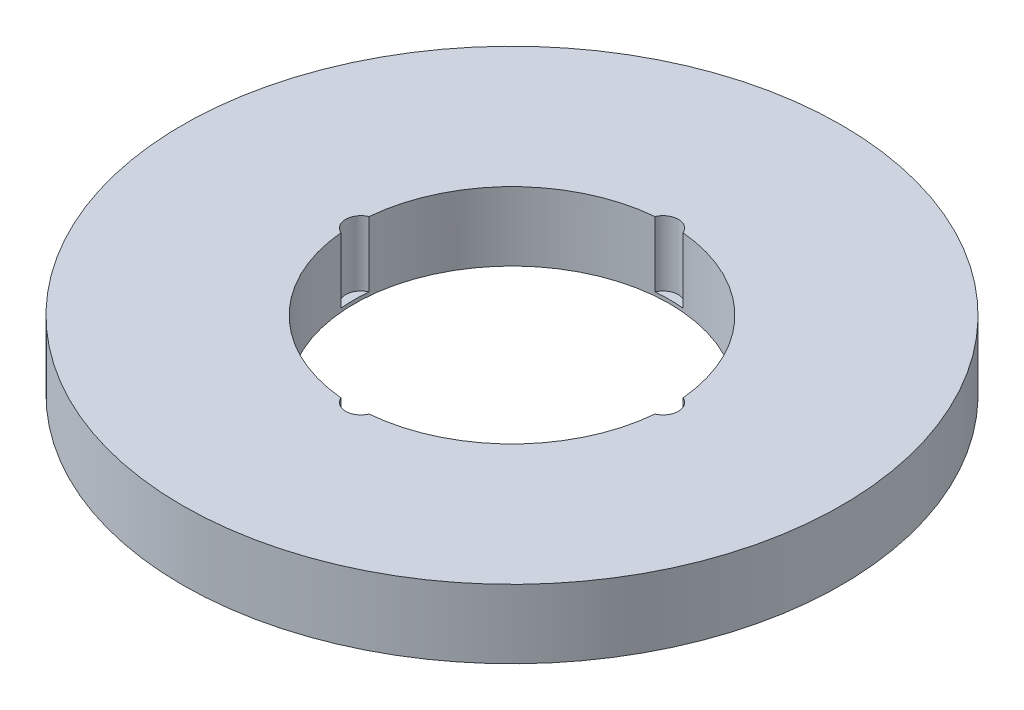
from build123d import *

# Parameters (mm, degrees)
SKETCH1_R           = 57.5
BOSS_EXTRUDE1_DEPTH = 12
SKETCH2_R           = 27.5
CUT_EXTRUDE1_DEPTH  = 83.197931847
SKETCH3_R           = 2.656470454
CUT_EXTRUDE2_DEPTH  = 11.388552756
CIRPATTERN1_COUNT   = 4


with BuildPart() as part:
    # Sketch1 → Boss-Extrude1 (new body)
    with BuildSketch(Plane(origin=(0, 0, 0), x_dir=(1, 0, 0), z_dir=(0, 1, 0))):
        Circle(SKETCH1_R)
    extrude(amount=BOSS_EXTRUDE1_DEPTH)

    # Sketch2 → Cut-Extrude1 (cut, through all)
    with BuildSketch(Plane(origin=(0, 0, 0), x_dir=(1, 0, 0), z_dir=(0, 1, 0))):
        Circle(SKETCH2_R)
    extrude(amount=CUT_EXTRUDE1_DEPTH, mode=Mode.SUBTRACT)

    # Sketch3 → Cut-Extrude2 (cut)
    with BuildSketch(Plane(origin=(0, 12, 0), x_dir=(1, 0, 0), z_dir=(0, 1, 0))):
        with Locations((-26.361412249, 0)):
            Circle(SKETCH3_R)
    cut_extrude2 = extrude(amount=-CUT_EXTRUDE2_DEPTH, mode=Mode.SUBTRACT)

    # CirPattern1: Cut-Extrude2 ×4 about axis
    cirpattern1_axis = Axis((0, 0, 0), (0, 1, 0))
    for i in range(1, CIRPATTERN1_COUNT):
        add(cut_extrude2.rotate(cirpattern1_axis, i * 360 / CIRPATTERN1_COUNT), mode=Mode.SUBTRACT)


solid = part.part
